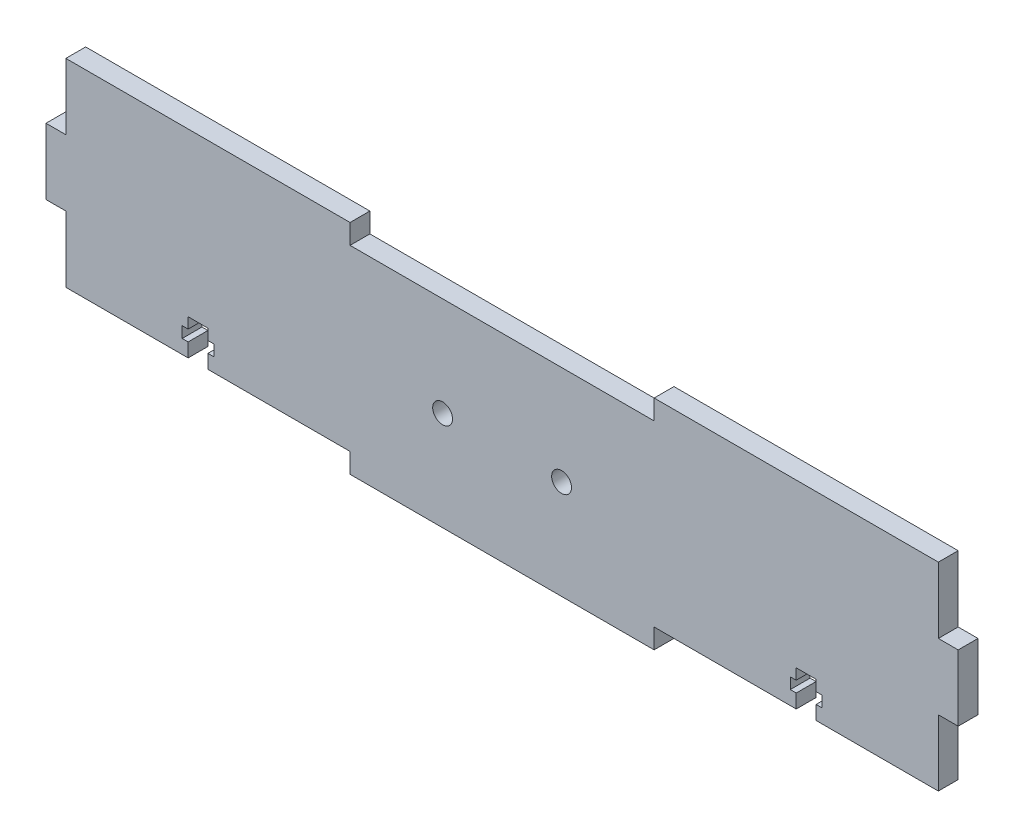
from build123d import *

# Parameters (mm, degrees)
SALIENTE_EXTRUIR1_DEPTH = 5
CORTAR_EXTRUIR1_DEPTH   = 5
CROQUIS3_W              = 76.666666666
CROQUIS3_H              = 5
CORTAR_EXTRUIR2_DEPTH   = 10
CROQUIS4_R              = 2.5
CORTAR_EXTRUIR3_DEPTH   = 10


with BuildPart() as part:
    # Croquis1 → Saliente-Extruir1 (new body)
    with BuildSketch(Plane.XY):
        Polygon((76.666666667, 0), (153.333333333, 0), (153.333333333, 5), (225, 5), (225, 21.666666667), (230, 21.666666667), (230, 38.333333333), (225, 38.333333333), (225, 55), (5, 55), (5, 38.333333333), (0, 38.333333333), (0, 21.666666667), (5, 21.666666667), (5, 5), (76.666666667, 5), align=None)
    extrude(amount=SALIENTE_EXTRUIR1_DEPTH)

    # Croquis2 → Cortar-Extruir1 (cut)
    with BuildSketch(Plane.XY.offset(5)):
        Polygon((35.833333333, 5), (35.833333333, 8.5), (34.333333333, 8.5), (34.333333333, 11.3), (35.833333333, 11.3), (35.833333333, 14), (40.833333333, 14), (40.833333333, 11.3), (42.333333333, 11.3), (42.333333333, 8.5), (40.833333333, 8.5), (40.833333333, 5), align=None)
        Polygon((189.166666667, 5), (189.166666667, 8.5), (187.666666667, 8.5), (187.666666667, 11.3), (189.166666667, 11.3), (189.166666667, 14), (194.166666667, 14), (194.166666667, 11.3), (195.666666667, 11.3), (195.666666667, 8.5), (194.166666667, 8.5), (194.166666667, 5), align=None)
    extrude(amount=-CORTAR_EXTRUIR1_DEPTH, mode=Mode.SUBTRACT)

    # Croquis3 → Cortar-Extruir2 (cut)
    with BuildSketch(Plane.XY.offset(5)):
        with Locations((115, 52.5)):
            Rectangle(CROQUIS3_W, CROQUIS3_H)
    extrude(amount=-CORTAR_EXTRUIR2_DEPTH, mode=Mode.SUBTRACT)

    # Croquis4 → Cortar-Extruir3 (cut)
    with BuildSketch(Plane.XY.offset(5)):
        with Locations((100, 25)):
            Circle(CROQUIS4_R)
        with Locations((130, 25)):
            Circle(CROQUIS4_R)
    extrude(amount=-CORTAR_EXTRUIR3_DEPTH, mode=Mode.SUBTRACT)


solid = part.part
